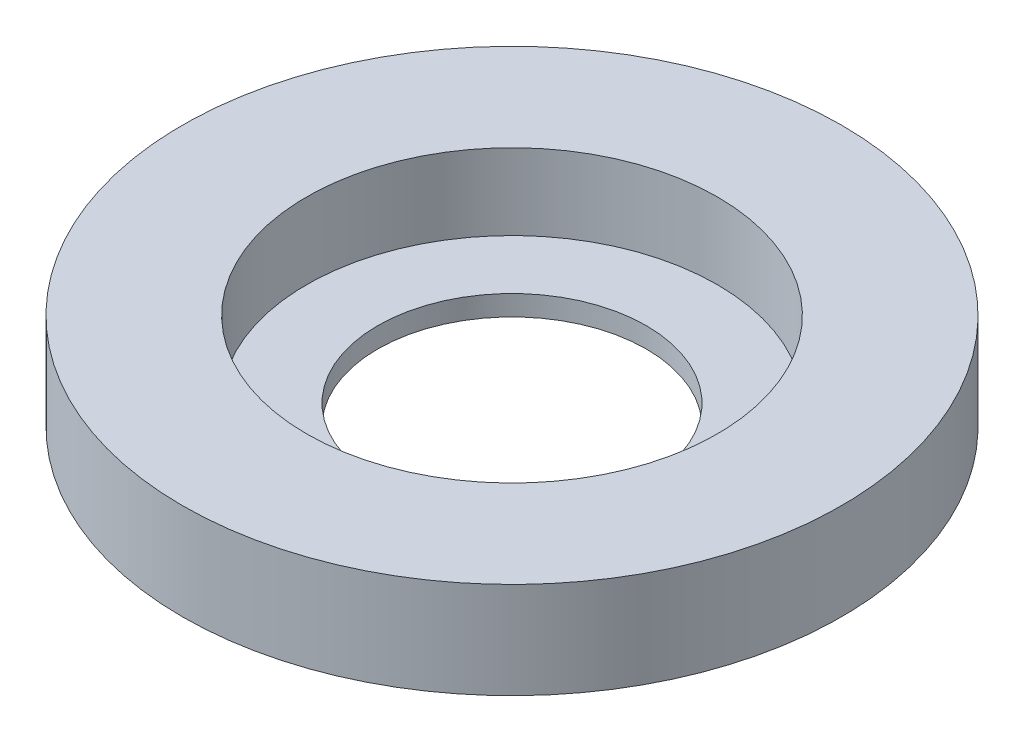
from build123d import *


with BuildPart() as part:
    # Sketch1 → Revolve1 (revolve)
    with BuildSketch(Plane.XY):
        Polygon((5.3, 0), (13, 0), (13, 3.8), (8.1, 3.8), (8.1, 0.8), (5.3, 0.8), align=None)
    revolve(axis=Axis((0, 0, 0), (0, 1, 0)))


solid = part.part
